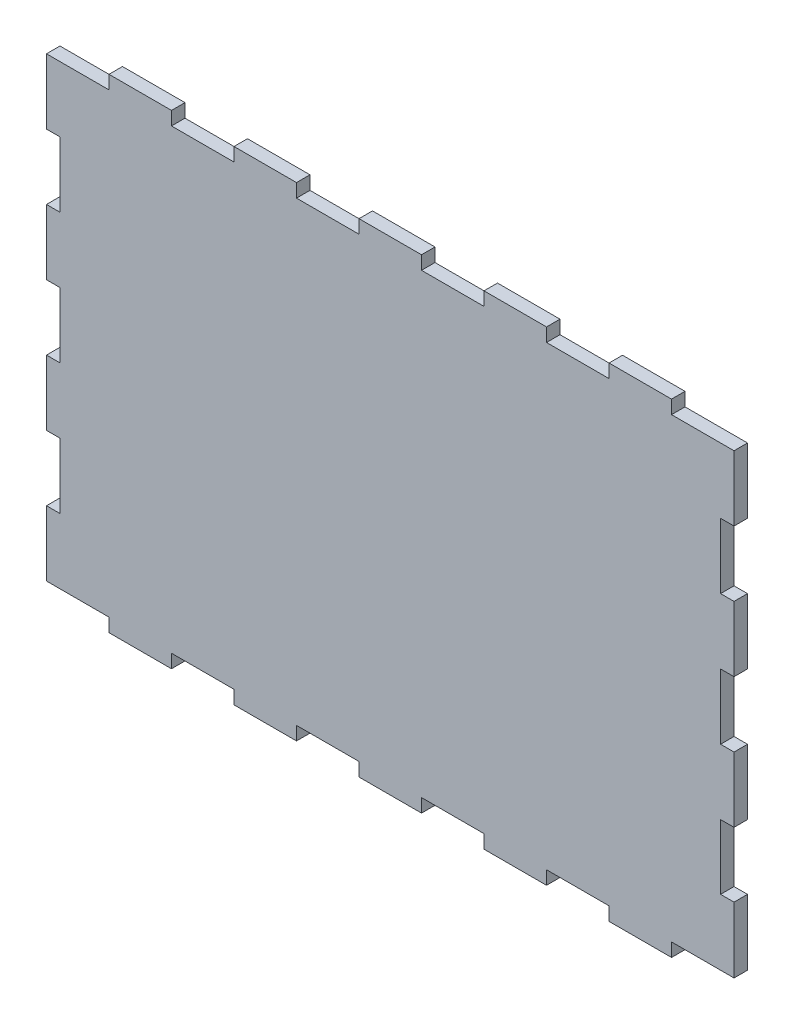
from build123d import *

# Parameters (mm, degrees)
SALIENTE_EXTRUIR1_DEPTH = 3


with BuildPart() as part:
    # Croquis1 → Saliente-Extruir1 (new body)
    with BuildSketch(Plane.XY):
        Polygon((-34.480909091, -153.100114598), (-34.480909091, -156.100114598), (-48.39, -156.100114598), (-48.39, -170.615828883), (-45.39, -170.615828883), (-45.39, -185.131543169), (-48.39, -185.131543169), (-48.39, -199.647257455), (-45.39, -199.647257455), (-45.39, -214.162971741), (-48.39, -214.162971741), (-48.39, -228.678686026), (-45.39, -228.678686026), (-45.39, -243.194400312), (-48.39, -243.194400312), (-48.39, -257.710114598), (-34.480909091, -257.710114598), (-34.480909091, -260.710114598), (-20.571818182, -260.710114598), (-20.571818182, -257.710114598), (-6.662727273, -257.710114598), (-6.662727273, -260.710114598), (7.246363636, -260.710114598), (7.246363636, -257.710114598), (21.155454545, -257.710114598), (21.155454545, -260.710114598), (35.064545455, -260.710114598), (35.064545455, -257.710114598), (48.973636364, -257.710114598), (48.973636364, -260.710114598), (62.882727273, -260.710114598), (62.882727273, -257.710114598), (76.791818182, -257.710114598), (76.791818182, -260.710114598), (90.700909091, -260.710114598), (90.700909091, -257.710114598), (104.61, -257.710114598), (104.61, -243.087661526), (101.61, -243.087661526), (101.61, -228.678686026), (104.61, -228.678686026), (104.61, -214.162971741), (101.61, -214.162971741), (101.61, -199.647257455), (104.61, -199.647257455), (104.61, -185.131543169), (101.61, -185.131543169), (101.61, -170.615828883), (104.61, -170.615828883), (104.61, -156.100114598), (90.700909091, -156.100114598), (90.700909091, -153.100114598), (76.791818182, -153.100114598), (76.791818182, -156.100114598), (62.882727273, -156.100114598), (62.882727273, -153.100114598), (48.973636364, -153.100114598), (48.973636364, -156.100114598), (35.064545455, -156.100114598), (35.064545455, -153.100114598), (21.155454545, -153.100114598), (21.155454545, -156.100114598), (7.246363636, -156.100114598), (7.246363636, -153.100114598), (-6.662727273, -153.100114598), (-6.662727273, -156.100114598), (-20.571818182, -156.100114598), (-20.571818182, -153.100114598), align=None)
    extrude(amount=SALIENTE_EXTRUIR1_DEPTH)


solid = part.part
